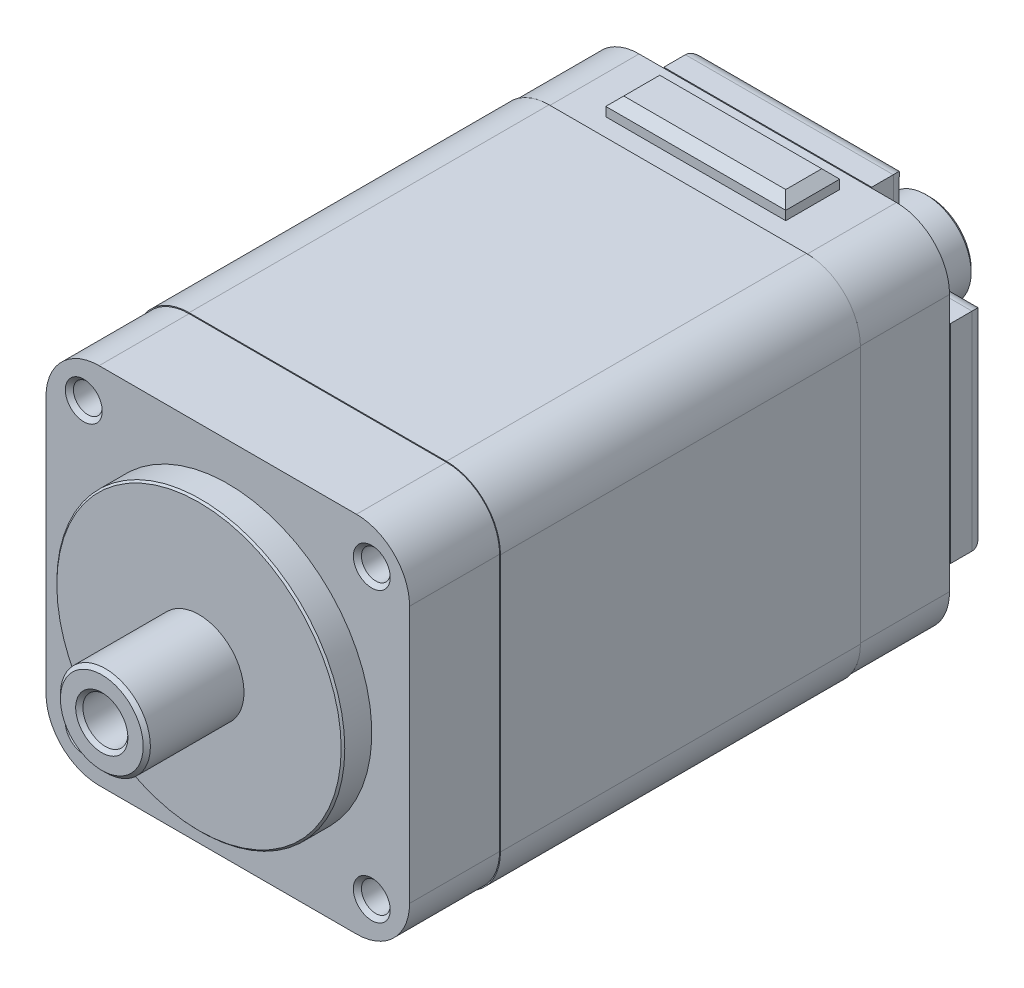
from build123d import *

# Parameters (mm, degrees)
MAIN_SKETCH_W                          = 30
MAIN_SKETCH_H                          = 20.3
MAIN_BODY_EXTRUDE_DEPTH                = 10.15
BOTTOM_CIRCULAR_PROTRUSION_SKETCH_R    = 8
BOTTOM_CIRCULAR_PROTRUSION_DEPTH       = 1.6
BOTTOM_PROTRUSION_CHAMFER_SIZE         = 0.1
SHAFT_OUTSIDE_DEPTH                    = 5.4
SHAFT_OUTSIDE_DEPTH_BACK               = 40.6
SHAFT_OUTSIDE_SKETCH_R                 = 2.5
HOLLOW_OUT_SHAFT_CUT_DEPTH             = 49.18760214
HOLLOW_OUT_SHAFT_CUT_DEPTH_BACK        = 49.18760214
SKETCH4_R                              = 1.25
SHAFT_CHAMFER_SIZE                     = 0.2
MOUNTING_HOLE_LOCATION_SKETCH_R        = 0.5
MOUNTING_HOLE_CUT_LOCATIONS_DEPTH      = 2
ASSEMBLY_START                         = -2
ASSEMBLY_SCREW_HOLES_POSITION_SKETCH_R = 0.5
ASSEMBLY_SCREW_HOLES_DEPTH             = 2
BODY_CORNER_FILLETS_R                  = 3
COVER_SKETCH_R                         = 2.5
COVER_EXTRUDE_DEPTH                    = 2
COVER_FILLET_R                         = 0.8
CONNECTOR_SKETCH_W                     = 10
CONNECTOR_SKETCH_H                     = 3
CONNECTOR_EXTRUDE_DEPTH                = 1
CONNECTOR_CHAMFER_SIZE                 = 0.5
BODY_BOTTOM_TRIM_DEPTH                 = 5
BODY_START                             = -5
BODY_TOP_TRIM_DEPTH                    = 5


# Read off the part's stored shape, not the designer's step: M2 Tapped Holes
with BuildPart() as part:
    # Main Sketch → Main Body Extrude (new, symmetric)
    with BuildSketch(Plane(origin=(0, 0, 0), x_dir=(0, 0, -1), z_dir=(1, 0, 0))):
        Rectangle(MAIN_SKETCH_W, MAIN_SKETCH_H)
    extrude(amount=MAIN_BODY_EXTRUDE_DEPTH, both=True)

    # Bottom Circular Protrusion Sketch → Bottom Circular Protrusion (add)
    with BuildSketch(Plane.XY.offset(15)):
        with Locations(Location((0, 0, 0), (0, 0, 180))):
            Circle(BOTTOM_CIRCULAR_PROTRUSION_SKETCH_R)
    extrude(amount=BOTTOM_CIRCULAR_PROTRUSION_DEPTH)

    # Bottom Protrusion Chamfer
    bottom_protrusion_chamfer_edges = [part.edges().sort_by_distance(p)[0] for p in [
        (8, 0, 16.6),
    ]]
    chamfer(bottom_protrusion_chamfer_edges, length=BOTTOM_PROTRUSION_CHAMFER_SIZE)


with BuildPart() as body_2:
    # Shaft Outside Sketch → Shaft Outside (new, two sides: drawn at the far end of the back side and taken through both)
    with BuildSketch(Plane.XY.offset(16.6).offset(-SHAFT_OUTSIDE_DEPTH_BACK)):
        Circle(SHAFT_OUTSIDE_SKETCH_R)
    extrude(amount=SHAFT_OUTSIDE_DEPTH + SHAFT_OUTSIDE_DEPTH_BACK)


with BuildPart() as hollow_out_shaft_cut_tool:
    # Sketch4 → Hollow Out Shaft Cut (new, two sides: drawn at the far end of the back side and taken through both)
    with BuildSketch(Plane.XY.offset(22).offset(-HOLLOW_OUT_SHAFT_CUT_DEPTH_BACK)):
        Circle(SKETCH4_R)
    extrude(amount=HOLLOW_OUT_SHAFT_CUT_DEPTH + HOLLOW_OUT_SHAFT_CUT_DEPTH_BACK)


with BuildPart() as part_1:
    add(part.part)

    # Hollow Out Shaft Cut: cut by hollow_out_shaft_cut_tool
    add(hollow_out_shaft_cut_tool.part, mode=Mode.SUBTRACT)

    # Mounting Hole Location Sketch → Mounting Hole Cut Locations (cut)
    with BuildSketch(Plane.XY.offset(15)):
        with Locations((-8, 8)):
            Circle(MOUNTING_HOLE_LOCATION_SKETCH_R)
        with Locations((8, 8)):
            Circle(MOUNTING_HOLE_LOCATION_SKETCH_R)
        with Locations((8, -8)):
            Circle(MOUNTING_HOLE_LOCATION_SKETCH_R)
        with Locations((-8, -8)):
            Circle(MOUNTING_HOLE_LOCATION_SKETCH_R)
    extrude(amount=-MOUNTING_HOLE_CUT_LOCATIONS_DEPTH, mode=Mode.SUBTRACT)

    # Assembly Screw Holes Position Sketch → Assembly Screw Holes (cut)
    with BuildSketch(Plane(origin=(0, 0, -15), x_dir=(-1, 0, 0), z_dir=(0, 0, -1)).offset(ASSEMBLY_START)):
        with Locations(Location((8, -8, 0), (0, 0, 180))):
            Circle(ASSEMBLY_SCREW_HOLES_POSITION_SKETCH_R)
        with Locations(Location((-8, -8, 0), (0, 0, 180))):
            Circle(ASSEMBLY_SCREW_HOLES_POSITION_SKETCH_R)
        with Locations(Location((-8, 8, 0), (0, 0, 180))):
            Circle(ASSEMBLY_SCREW_HOLES_POSITION_SKETCH_R)
        with Locations(Location((8, 8, 0), (0, 0, 180))):
            Circle(ASSEMBLY_SCREW_HOLES_POSITION_SKETCH_R)
    extrude(amount=ASSEMBLY_SCREW_HOLES_DEPTH, mode=Mode.SUBTRACT)

    # M2 Tapped Holes outline → M2 Tapped Holes (revolve, cut)
    with BuildSketch(Plane(origin=(-8, 8, 0), x_dir=(1, 0, 0), z_dir=(0, -1, 0))):
        Polygon((0, -11.519311505), (0, -13), (0.5, -13), (0.5, -15), (1.025, -15), (0.8, -14.775), (0.8, -12), align=None)
        Polygon((0, 13), (0, 11.519311505), (0.8, 12), (0.8, 14.775), (1.025, 15), (0.5, 15), (0.5, 13), align=None)
    revolve(axis=Axis((-8, 8, 0), (0, 0, 1)), mode=Mode.SUBTRACT)

    # M2 Tapped Holes 2 outline → M2 Tapped Holes 2 (revolve, cut)
    with BuildSketch(Plane(origin=(8, -8, 0), x_dir=(1, 0, 0), z_dir=(0, -1, 0))):
        Polygon((0, -11.519311505), (0, -13), (0.5, -13), (0.5, -15), (1.025, -15), (0.8, -14.775), (0.8, -12), align=None)
        Polygon((0, 13), (0, 11.519311505), (0.8, 12), (0.8, 14.775), (1.025, 15), (0.5, 15), (0.5, 13), align=None)
    revolve(axis=Axis((8, -8, 0), (0, 0, 1)), mode=Mode.SUBTRACT)

    # M2 Tapped Holes 3 outline → M2 Tapped Holes 3 (revolve, cut)
    with BuildSketch(Plane(origin=(8, 8, 0), x_dir=(1, 0, 0), z_dir=(0, -1, 0))):
        Polygon((0, -11.519311505), (0, -13), (0.5, -13), (0.5, -15), (1.025, -15), (0.8, -14.775), (0.8, -12), align=None)
        Polygon((0, 13), (0, 11.519311505), (0.8, 12), (0.8, 14.775), (1.025, 15), (0.5, 15), (0.5, 13), align=None)
    revolve(axis=Axis((8, 8, 0), (0, 0, 1)), mode=Mode.SUBTRACT)

    # M2 Tapped Holes 4 outline → M2 Tapped Holes 4 (revolve, cut)
    with BuildSketch(Plane(origin=(-8, -8, 0), x_dir=(1, 0, 0), z_dir=(0, -1, 0))):
        Polygon((0, -11.519311505), (0, -13), (0.5, -13), (0.5, -15), (1.025, -15), (0.8, -14.775), (0.8, -12), align=None)
        Polygon((0, 13), (0, 11.519311505), (0.8, 12), (0.8, 14.775), (1.025, 15), (0.5, 15), (0.5, 13), align=None)
    revolve(axis=Axis((-8, -8, 0), (0, 0, 1)), mode=Mode.SUBTRACT)

    # Body Corner Fillets
    body_corner_fillets_edges = [part_1.edges().sort_by_distance(p)[0] for p in [
        (10.15, -10.15, 0),
        (-10.15, -10.15, 0),
        (-10.15, 10.15, 0),
        (10.15, 10.15, 0),
    ]]
    fillet(body_corner_fillets_edges, radius=BODY_CORNER_FILLETS_R)

    # Connector Sketch → Connector Extrude (add)
    with BuildSketch(Plane(origin=(0, 10.15, 0), x_dir=(1, 0, 0), z_dir=(0, 1, 0))):
        with Locations((0, 12.5)):
            Rectangle(CONNECTOR_SKETCH_W, CONNECTOR_SKETCH_H)
    extrude(amount=CONNECTOR_EXTRUDE_DEPTH)

    # Connector Chamfer
    connector_chamfer_edges = [part_1.edges().sort_by_distance(p)[0] for p in [
        (-5, 11.15, -12.5),
        (0, 11.15, -11),
        (5, 11.15, -12.5),
        (0, 11.15, -14),
    ]]
    chamfer(connector_chamfer_edges, length=CONNECTOR_CHAMFER_SIZE)

    # Body Top Trim Sketch → Body Bottom Trim (cut)
    with BuildSketch(Plane.XY.offset(15)):
        with BuildLine():
            Line((10.15, -7.15), (10.15, 7.15))
            ThreePointArc((10.15, 7.15), (9.271320344, 9.271320344), (7.15, 10.15))
            Line((7.15, 10.15), (-7.15, 10.15))
            ThreePointArc((-7.15, 10.15), (-9.271320344, 9.271320344), (-10.15, 7.15))
            Line((-10.15, 7.15), (-10.15, -7.15))
            ThreePointArc((-10.15, -7.15), (-9.271320344, -9.271320344), (-7.15, -10.15))
            Line((-7.15, -10.15), (7.15, -10.15))
            ThreePointArc((7.15, -10.15), (9.271320344, -9.271320344), (10.15, -7.15))
        make_face()
        with BuildLine():
            Line((10.1, -7.15), (10.1, 7.15))
            ThreePointArc((10.1, 7.15), (9.235965005, 9.235965005), (7.15, 10.1))
            Line((7.15, 10.1), (-7.15, 10.1))
            ThreePointArc((-7.15, 10.1), (-9.235965005, 9.235965005), (-10.1, 7.15))
            Line((-10.1, 7.15), (-10.1, -7.15))
            ThreePointArc((-10.1, -7.15), (-9.235965005, -9.235965005), (-7.15, -10.1))
            Line((-7.15, -10.1), (7.15, -10.1))
            ThreePointArc((7.15, -10.1), (9.235965005, -9.235965005), (10.1, -7.15))
        make_face(mode=Mode.SUBTRACT)
    extrude(amount=-BODY_BOTTOM_TRIM_DEPTH, mode=Mode.SUBTRACT)

    # Body Bottom Trim Sketch → Body Top Trim (cut)
    with BuildSketch(Plane(origin=(0, 0, -15), x_dir=(-1, 0, 0), z_dir=(0, 0, -1)).offset(BODY_START)):
        with BuildLine():
            Line((7.15, 10.15), (-7.15, 10.15))
            ThreePointArc((-7.15, 10.15), (-9.271320344, 9.271320344), (-10.15, 7.15))
            Line((-10.15, 7.15), (-10.15, -7.15))
            ThreePointArc((-10.15, -7.15), (-9.271320344, -9.271320344), (-7.15, -10.15))
            Line((-7.15, -10.15), (7.15, -10.15))
            ThreePointArc((7.15, -10.15), (9.271320344, -9.271320344), (10.15, -7.15))
            Line((10.15, -7.15), (10.15, 7.15))
            ThreePointArc((10.15, 7.15), (9.271320344, 9.271320344), (7.15, 10.15))
        make_face()
        with BuildLine():
            Line((-10.1, 7.15), (-10.1, -7.15))
            ThreePointArc((-10.1, -7.15), (-9.235965005, -9.235965005), (-7.15, -10.1))
            Line((-7.15, -10.1), (7.15, -10.1))
            ThreePointArc((7.15, -10.1), (9.235965005, -9.235965005), (10.1, -7.15))
            Line((10.1, -7.15), (10.1, 7.15))
            ThreePointArc((10.1, 7.15), (9.235965005, 9.235965005), (7.15, 10.1))
            Line((7.15, 10.1), (-7.15, 10.1))
            ThreePointArc((-7.15, 10.1), (-9.235965005, 9.235965005), (-10.1, 7.15))
        make_face(mode=Mode.SUBTRACT)
    extrude(amount=BODY_TOP_TRIM_DEPTH, mode=Mode.SUBTRACT)


with BuildPart() as body_2_1:
    add(body_2.part)

    # Hollow Out Shaft Cut: cut by hollow_out_shaft_cut_tool
    add(hollow_out_shaft_cut_tool.part, mode=Mode.SUBTRACT)

    # Shaft Chamfer
    shaft_chamfer_edges = [body_2_1.edges().sort_by_distance(p)[0] for p in [
        (-1.25, 0, 22),
        (-1.25, 0, -24),
        (-2.5, 0, -24),
        (-2.5, 0, 22),
    ]]
    chamfer(shaft_chamfer_edges, length=SHAFT_CHAMFER_SIZE)


with BuildPart() as body_3:
    # Cover Sketch → Cover Extrude (new body)
    with BuildSketch(Plane(origin=(0, 0, -15), x_dir=(-1, 0, 0), z_dir=(0, 0, -1))):
        with BuildLine():
            ThreePointArc((-5.775, 8), (-6.426687412, 6.426687412), (-8, 5.775))
            Line((-8, 5.775), (-10.15, 5.775))
            Line((-10.15, 5.775), (-10.15, -5.775))
            Line((-10.15, -5.775), (-8, -5.775))
            ThreePointArc((-8, -5.775), (-6.426687412, -6.426687412), (-5.775, -8))
            Line((-5.775, -8), (-5.775, -10.15))
            Line((-5.775, -10.15), (5.775, -10.15))
            Line((5.775, -10.15), (5.775, -8))
            ThreePointArc((5.775, -8), (6.426687412, -6.426687412), (8, -5.775))
            Line((8, -5.775), (10.15, -5.775))
            Line((10.15, -5.775), (10.15, 5.775))
            Line((10.15, 5.775), (8, 5.775))
            ThreePointArc((8, 5.775), (6.426687412, 6.426687412), (5.775, 8))
            Line((5.775, 8), (5.775, 10.15))
            Line((5.775, 10.15), (-5.775, 10.15))
            Line((-5.775, 10.15), (-5.775, 8))
        make_face()
        Circle(COVER_SKETCH_R, mode=Mode.SUBTRACT)
    extrude(amount=COVER_EXTRUDE_DEPTH)

    # Cover Fillet
    cover_fillet_edges = [body_3.edges().sort_by_distance(p)[0] for p in [
        (-6.426687412, -6.426687412, -17),
        (-9.075, -5.775, -17),
        (-10.15, 0, -17),
        (-9.075, 5.775, -17),
        (-6.426687412, 6.426687412, -17),
        (-5.775, 9.075, -17),
        (0, 10.15, -17),
        (5.775, 9.075, -17),
        (6.426687412, 6.426687412, -17),
        (9.075, 5.775, -17),
        (10.15, 0, -17),
        (9.075, -5.775, -17),
        (6.426687412, -6.426687412, -17),
        (5.775, -9.075, -17),
        (0, -10.15, -17),
        (-5.775, -9.075, -17),
    ]]
    fillet(cover_fillet_edges, radius=COVER_FILLET_R)


with BuildPart() as body_top_trim_piece_1:
    # of the separate pieces the step leaves, piece 1, a body of its own (body_top_trim_pieces)
    add(part_1.part.solids().sort_by_distance((-7.15, 10.15, -10))[0])


with BuildPart() as body_top_trim_piece_2:
    # of the separate pieces the step leaves, piece 2, a body of its own (body_top_trim_pieces)
    add(part_1.part.solids().sort_by_distance((5, 10.65, -14))[0])


solid = Compound([body_2_1.part, body_3.part, body_top_trim_piece_1.part, body_top_trim_piece_2.part])
